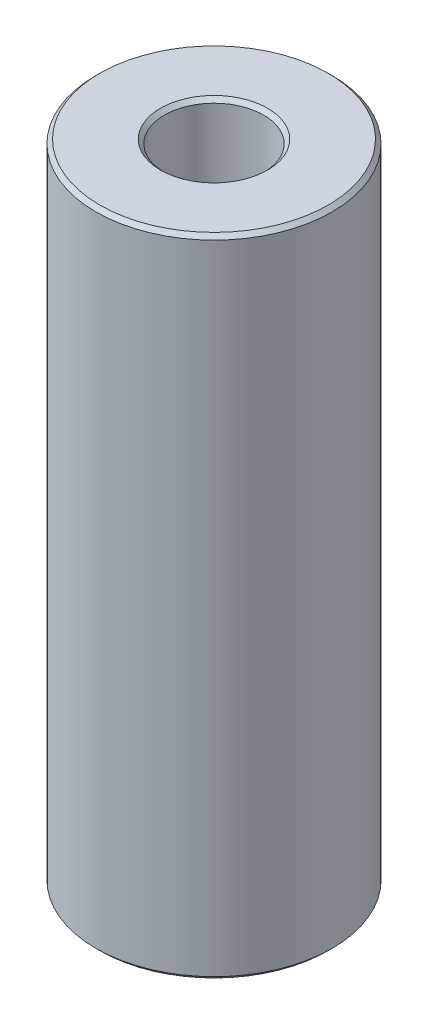
from build123d import *

# Parameters (mm, degrees)
SKETCH1_R           = 60
BOSS_EXTRUDE1_DEPTH = 327.974703964
SKETCH2_R           = 25.218248634
CUT_EXTRUDE1_DEPTH  = 339.773385083
CHAMFER1_SIZE       = 2.000174201


with BuildPart() as part:
    # Sketch1 → Boss-Extrude1 (new body)
    with BuildSketch(Plane(origin=(0, 0, 0), x_dir=(1, 0, 0), z_dir=(0, 1, 0))):
        Circle(SKETCH1_R)
    extrude(amount=BOSS_EXTRUDE1_DEPTH)

    # Sketch2 → Cut-Extrude1 (cut, through all)
    with BuildSketch(Plane(origin=(0, 0, 0), x_dir=(1, 0, 0), z_dir=(0, 1, 0))):
        Circle(SKETCH2_R)
    extrude(amount=CUT_EXTRUDE1_DEPTH, mode=Mode.SUBTRACT)

    # Chamfer1
    chamfer1_edges = [part.edges().sort_by_distance(p)[0] for p in [
        (-25.218248634, 327.974703964, 0),
        (-25.218248634, 0, 0),
        (-60, 0, 0),
        (-60, 327.974703964, 0),
    ]]
    chamfer(chamfer1_edges, length=CHAMFER1_SIZE)


solid = part.part
